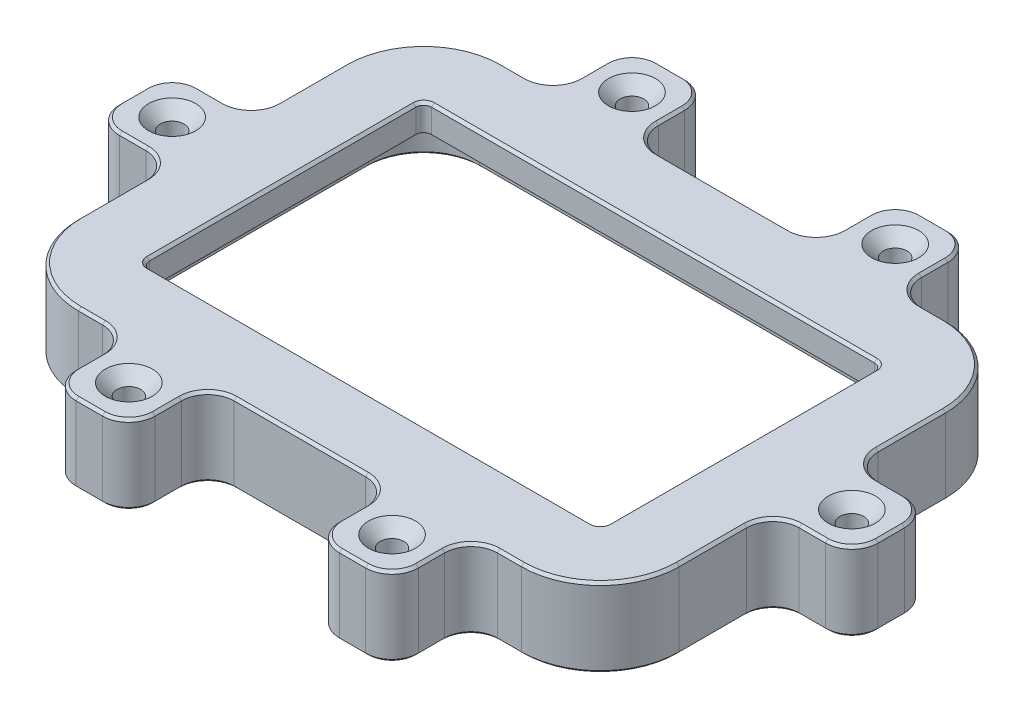
from build123d import *

# Parameters (mm, degrees)
BODY_DELETE_KEEP_START        = 26
BODY_DELETE_KEEP_2_DEPTH      = 15
BODY_DELETE_KEEP_START_2      = 36
BODY_DELETE_KEEP_2_2_DEPTH    = 5
SKETCH121_W                   = 15
SKETCH121_H                   = 15
BOSS_EXTRUDE1_DEPTH           = 15
CSK_FOR_M4_SFHCS1_D           = 4.5
CSK_FOR_M4_SFHCS1_CSINK_D     = 8.96
CSK_FOR_M4_SFHCS1_CSINK_ANGLE = 90
SKETCH122_W                   = 15
SKETCH122_H                   = 15
BOSS_EXTRUDE2_DEPTH           = 15
CSK_FOR_M4_SFHCS2_D           = 4.5
CSK_FOR_M4_SFHCS2_CSINK_D     = 8.96
CSK_FOR_M4_SFHCS2_CSINK_ANGLE = 90
MIRROR4_COPY_1_SKETCH_W       = 15
MIRROR4_COPY_1_SKETCH_H       = 15
MIRROR4_COPY_1_DEPTH          = 15
MIRROR4_COPY_2_D              = 4.5
MIRROR4_COPY_2_CSINK_D        = 8.96
MIRROR4_COPY_2_CSINK_ANGLE    = 90
FILLET3_R                     = 5
CHAMFER1_SIZE                 = 0.5


# Read off the part's stored shape, not the designer's step: Body-Delete/Keep 2
with BuildPart() as part:
    # Body-Delete/Keep 2 outline → Body-Delete/Keep 2 (new body)
    with BuildSketch(Plane(origin=(0, 0, 0), x_dir=(1, 0, 0), z_dir=(0, 1, 0)).offset(BODY_DELETE_KEEP_START)):
        with BuildLine():
            ThreePointArc((-58.033758581, 7.702411956), (-53.640360299, -2.904189762), (-43.033758581, -7.297588044))
            Line((-43.033758581, -7.297588044), (41.092277245, -7.297588044))
            ThreePointArc((41.092277245, -7.297588044), (51.698878963, -2.904189762), (56.092277245, 7.702411956))
            Line((56.092277245, 7.702411956), (56.092277245, 58.282893218))
            ThreePointArc((56.092277245, 58.282893218), (51.698878963, 68.889494936), (41.092277245, 73.282893218))
            Line((41.092277245, 73.282893218), (-43.033758581, 73.282893218))
            ThreePointArc((-43.033758581, 73.282893218), (-53.640360299, 68.889494936), (-58.033758581, 58.282893218))
            Line((-58.033758581, 58.282893218), (-58.033758581, 7.702411956))
        make_face()
        with BuildLine():
            ThreePointArc((-43.033758581, -2.797588044), (-50.458379784, 0.277790753), (-53.533758581, 7.702411956))
            Line((-53.533758581, 7.702411956), (-53.533758581, 58.282893218))
            ThreePointArc((-53.533758581, 58.282893218), (-50.458379784, 65.707514421), (-43.033758581, 68.782893218))
            Line((-43.033758581, 68.782893218), (41.092277245, 68.782893218))
            ThreePointArc((41.092277245, 68.782893218), (48.516898448, 65.707514421), (51.592277245, 58.282893218))
            Line((51.592277245, 58.282893218), (51.592277245, 7.702411956))
            ThreePointArc((51.592277245, 7.702411956), (48.516898448, 0.277790753), (41.092277245, -2.797588044))
            Line((41.092277245, -2.797588044), (-43.033758581, -2.797588044))
        make_face(mode=Mode.SUBTRACT)
    extrude(amount=BODY_DELETE_KEEP_2_DEPTH)

    # Body-Delete_Keep 2 2 outline → Body-Delete_Keep 2 2 (add)
    with BuildSketch(Plane(origin=(0, 0, 0), x_dir=(1, 0, 0), z_dir=(0, 1, 0)).offset(BODY_DELETE_KEEP_START_2)):
        with BuildLine():
            Line((-53.533758581, 58.282893218), (-53.533758581, 7.702411956))
            ThreePointArc((-53.533758581, 7.702411956), (-50.458379784, 0.277790753), (-43.033758581, -2.797588044))
            Line((-43.033758581, -2.797588044), (41.092277245, -2.797588044))
            ThreePointArc((41.092277245, -2.797588044), (48.516898448, 0.277790753), (51.592277245, 7.702411956))
            Line((51.592277245, 7.702411956), (51.592277245, 58.282893218))
            ThreePointArc((51.592277245, 58.282893218), (48.516898448, 65.707514421), (41.092277245, 68.782893218))
            Line((41.092277245, 68.782893218), (-43.033758581, 68.782893218))
            ThreePointArc((-43.033758581, 68.782893218), (-50.458379784, 65.707514421), (-53.533758581, 58.282893218))
        make_face()
        with BuildLine():
            Line((41.092277245, 6.202411956), (-43.033758581, 6.202411956))
            ThreePointArc((-43.033758581, 6.202411956), (-44.094418753, 6.641751784), (-44.533758581, 7.702411956))
            Line((-44.533758581, 7.702411956), (-44.533758581, 58.282893218))
            ThreePointArc((-44.533758581, 58.282893218), (-44.094418753, 59.34355339), (-43.033758581, 59.782893218))
            Line((-43.033758581, 59.782893218), (41.092277245, 59.782893218))
            ThreePointArc((41.092277245, 59.782893218), (42.152937417, 59.34355339), (42.592277245, 58.282893218))
            Line((42.592277245, 58.282893218), (42.592277245, 7.702411956))
            ThreePointArc((42.592277245, 7.702411956), (42.152937417, 6.641751784), (41.092277245, 6.202411956))
        make_face(mode=Mode.SUBTRACT)
    extrude(amount=BODY_DELETE_KEEP_2_2_DEPTH)

    # Sketch121 → Boss-Extrude1 (add)
    with BuildSketch(Plane.ZY.offset(58.033758581)):
        with Locations((-32.992652587, 33.5)):
            Rectangle(SKETCH121_W, SKETCH121_H)
    boss_extrude1 = extrude(amount=BOSS_EXTRUDE1_DEPTH)

    # CSK for M4 SFHCS1 (through all)
    with Locations(Plane(origin=(0, 41, 0), x_dir=(1, 0, 0), z_dir=(0, 1, 0))):
        with Locations((-65.533758581, 32.992652587)):
            csk_for_m4_sfhcs1 = CounterSinkHole(CSK_FOR_M4_SFHCS1_D / 2, CSK_FOR_M4_SFHCS1_CSINK_D / 2, counter_sink_angle=CSK_FOR_M4_SFHCS1_CSINK_ANGLE)

    # Mirror2: Boss-Extrude1, CSK for M4 SFHCS1 across plane
    add(boss_extrude1.mirror(Plane.ZY.offset(0.970740668)))
    add(csk_for_m4_sfhcs1.mirror(Plane.ZY.offset(0.970740668)), mode=Mode.SUBTRACT)

    # Sketch122 → Boss-Extrude2 (add)
    with BuildSketch(Plane.XY.offset(7.297588044)):
        with Locations((-25.970740668, 33.5)):
            Rectangle(SKETCH122_W, SKETCH122_H)
    boss_extrude2 = extrude(amount=BOSS_EXTRUDE2_DEPTH)

    # CSK for M4 SFHCS2 (through all)
    with Locations(Plane(origin=(0, 41, 0), x_dir=(1, 0, 0), z_dir=(0, 1, 0))):
        with Locations((-25.970740668, -14.797588044)):
            csk_for_m4_sfhcs2 = CounterSinkHole(CSK_FOR_M4_SFHCS2_D / 2, CSK_FOR_M4_SFHCS2_CSINK_D / 2, counter_sink_angle=CSK_FOR_M4_SFHCS2_CSINK_ANGLE)

    # Mirror3: Boss-Extrude2, CSK for M4 SFHCS2 across plane
    add(boss_extrude2.mirror(Plane.XY.offset(-32.992652587)))
    add(csk_for_m4_sfhcs2.mirror(Plane.XY.offset(-32.992652587)), mode=Mode.SUBTRACT)

    # Mirror4: Boss-Extrude2, CSK for M4 SFHCS2 across plane
    add(boss_extrude2.mirror(Plane.ZY.offset(0.970740668)))
    add(csk_for_m4_sfhcs2.mirror(Plane.ZY.offset(0.970740668)), mode=Mode.SUBTRACT)

    # Mirror4 copy 1 sketch → Mirror4 copy 1 (add)
    with BuildSketch(Plane(origin=(-1.941481336, 0, -73.282893218), x_dir=(-1, 0, 0), z_dir=(0, 0, -1))):
        with Locations((-25.970740668, 33.5)):
            Rectangle(MIRROR4_COPY_1_SKETCH_W, MIRROR4_COPY_1_SKETCH_H)
    extrude(amount=MIRROR4_COPY_1_DEPTH)

    # Mirror4 copy 2 (through all)
    with Locations(Plane(origin=(-1.941481336, 41, -65.985305174), x_dir=(-1, 0, 0), z_dir=(0, 1, 0))):
        with Locations((-25.970740668, -14.797588044)):
            CounterSinkHole(MIRROR4_COPY_2_D / 2, MIRROR4_COPY_2_CSINK_D / 2, counter_sink_angle=MIRROR4_COPY_2_CSINK_ANGLE)

    # Fillet3
    fillet3_edges = [part.edges().sort_by_distance(p)[0] for p in [
        (-58.033758581, 33.5, -40.492652587),
        (-58.033758581, 33.5, -25.492652587),
        (-73.033758581, 33.5, -40.492652587),
        (-73.033758581, 33.5, -25.492652587),
        (71.092277245, 33.5, -40.492652587),
        (71.092277245, 33.5, -25.492652587),
        (56.092277245, 33.5, -40.492652587),
        (56.092277245, 33.5, -25.492652587),
        (-33.470740668, 33.5, 7.297588044),
        (-18.470740668, 33.5, 7.297588044),
        (-33.470740668, 33.5, 22.297588044),
        (-18.470740668, 33.5, 22.297588044),
        (-33.470740668, 33.5, -88.282893218),
        (-18.470740668, 33.5, -88.282893218),
        (-33.470740668, 33.5, -73.282893218),
        (-18.470740668, 33.5, -73.282893218),
        (31.529259332, 33.5, -73.282893218),
        (16.529259332, 33.5, -73.282893218),
        (31.529259332, 33.5, -88.282893218),
        (16.529259332, 33.5, -88.282893218),
        (31.529259332, 33.5, 22.297588044),
        (16.529259332, 33.5, 22.297588044),
        (31.529259332, 33.5, 7.297588044),
        (16.529259332, 33.5, 7.297588044),
    ]]
    fillet(fillet3_edges, radius=FILLET3_R)

    # Chamfer1
    chamfer1_edges = [part.edges().sort_by_distance(p)[0] for p in [
        (-63.283758581, 26, -32.992652587),
        (51.698878963, 41, 2.904189762),
        (61.342277245, 26, -32.992652587),
        (-23.720740668, 26, 14.797588044),
        (56.092277245, 41, -14.097532271),
        (-23.720740668, 26, -80.782893218),
        (21.779259332, 26, -80.782893218),
        (51.698878963, 41, -68.889494936),
        (21.779259332, 26, 14.797588044),
        (-33.470740668, 26, 14.797588044),
        (-33.470740668, 41, 14.797588044),
        (-25.970740668, 26, 22.297588044),
        (-25.970740668, 41, 22.297588044),
        (-58.033758581, 26, -14.097532271),
        (-65.533758581, 26, -25.492652587),
        (-73.033758581, 26, -32.992652587),
        (-65.533758581, 26, -40.492652587),
        (-40.752249625, 26, -73.282893218),
        (-33.470740668, 26, -80.782893218),
        (-25.970740668, 26, -88.282893218),
        (-18.470740668, 26, -80.782893218),
        (-0.970740668, 26, -73.282893218),
        (16.529259332, 26, -80.782893218),
        (24.029259332, 26, -88.282893218),
        (31.529259332, 26, -80.782893218),
        (56.092277245, 26, -51.887772902),
        (63.592277245, 26, -40.492652587),
        (71.092277245, 26, -32.992652587),
        (63.592277245, 26, -25.492652587),
        (38.810768288, 26, 7.297588044),
        (31.529259332, 26, 14.797588044),
        (38.810768288, 41, -73.282893218),
        (24.029259332, 26, 22.297588044),
        (16.529259332, 26, 14.797588044),
        (-0.970740668, 26, 7.297588044),
        (-18.470740668, 26, 14.797588044),
        (-71.569292487, 26, -26.957118681),
        (-71.569292487, 26, -39.028186493),
        (-32.006274574, 26, -86.818427124),
        (-19.935206762, 26, -86.818427124),
        (17.993725426, 26, -86.818427124),
        (30.064793238, 26, -86.818427124),
        (69.627811151, 26, -39.028186493),
        (69.627811151, 26, -26.957118681),
        (30.064793238, 26, 20.83312195),
        (17.993725426, 26, 20.83312195),
        (-19.935206762, 26, 20.83312195),
        (-32.006274574, 26, 20.83312195),
        (-18.470740668, 41, 14.797588044),
        (-0.970740668, 41, 7.297588044),
        (16.529259332, 41, 14.797588044),
        (24.029259332, 41, 22.297588044),
        (31.529259332, 41, 14.797588044),
        (38.810768288, 41, 7.297588044),
        (63.592277245, 41, -25.492652587),
        (71.092277245, 41, -32.992652587),
        (63.592277245, 41, -40.492652587),
        (56.092277245, 41, -51.887772902),
        (31.529259332, 41, -80.782893218),
        (24.029259332, 41, -88.282893218),
        (16.529259332, 41, -80.782893218),
        (-0.970740668, 41, -73.282893218),
        (-18.470740668, 41, -80.782893218),
        (-25.970740668, 41, -88.282893218),
        (-33.470740668, 41, -80.782893218),
        (-40.752249625, 41, -73.282893218),
        (-65.533758581, 41, -40.492652587),
        (-73.033758581, 41, -32.992652587),
        (-65.533758581, 41, -25.492652587),
        (-58.033758581, 41, -14.097532271),
        (-71.569292487, 41, -26.957118681),
        (-71.569292487, 41, -39.028186493),
        (-32.006274574, 41, -86.818427124),
        (-19.935206762, 41, -86.818427124),
        (17.993725426, 41, -86.818427124),
        (30.064793238, 41, -86.818427124),
        (69.627811151, 41, -39.028186493),
        (69.627811151, 41, -26.957118681),
        (30.064793238, 41, 20.83312195),
        (17.993725426, 41, 20.83312195),
        (-19.935206762, 41, 20.83312195),
        (-53.640360299, 41, -68.889494936),
        (-32.006274574, 41, 20.83312195),
        (-44.094418753, 41, -6.641751784),
        (-0.970740668, 41, -6.202411956),
        (-34.935206762, 26, 8.762054138),
        (42.152937417, 41, -6.641751784),
        (-34.935206762, 41, 8.762054138),
        (-17.006274574, 41, 8.762054138),
        (-17.006274574, 26, 8.762054138),
        (42.592277245, 41, -32.992652587),
        (15.064793238, 41, 8.762054138),
        (15.064793238, 26, 8.762054138),
        (32.993725426, 26, 8.762054138),
        (42.152937417, 41, -59.34355339),
        (32.993725426, 41, 8.762054138),
        (57.556743339, 41, -24.028186493),
        (57.556743339, 26, -24.028186493),
        (-0.970740668, 41, -59.782893218),
        (57.556743339, 26, -41.957118681),
        (57.556743339, 41, -41.957118681),
        (32.993725426, 26, -74.747359312),
        (-44.094418753, 41, -59.34355339),
        (32.993725426, 41, -74.747359312),
        (15.064793238, 41, -74.747359312),
        (15.064793238, 26, -74.747359312),
        (-58.033758581, 41, -51.887772902),
        (-44.533758581, 41, -32.992652587),
        (-17.006274574, 41, -74.747359312),
        (-17.006274574, 26, -74.747359312),
        (-34.935206762, 26, -74.747359312),
        (-34.935206762, 41, -74.747359312),
        (-59.498224675, 26, -41.957118681),
        (-59.498224675, 41, -41.957118681),
        (-59.498224675, 41, -24.028186493),
        (-59.498224675, 26, -24.028186493),
        (-53.640360299, 41, 2.904189762),
        (-53.640360299, 26, 2.904189762),
        (-58.033758581, 26, -51.887772902),
        (-53.640360299, 26, -68.889494936),
        (38.810768288, 26, -73.282893218),
        (51.698878963, 26, -68.889494936),
        (56.092277245, 26, -14.097532271),
        (51.698878963, 26, 2.904189762),
        (-40.752249625, 26, 7.297588044),
        (-53.533758581, 26, -32.992652587),
        (-50.458379784, 26, -0.277790753),
        (-0.970740668, 26, 2.797588044),
        (48.516898448, 26, -0.277790753),
        (51.592277245, 26, -32.992652587),
        (48.516898448, 26, -65.707514421),
        (-0.970740668, 26, -68.782893218),
        (-50.458379784, 26, -65.707514421),
        (-40.752249625, 41, 7.297588044),
    ]]
    chamfer(chamfer1_edges, length=CHAMFER1_SIZE)


solid = part.part
